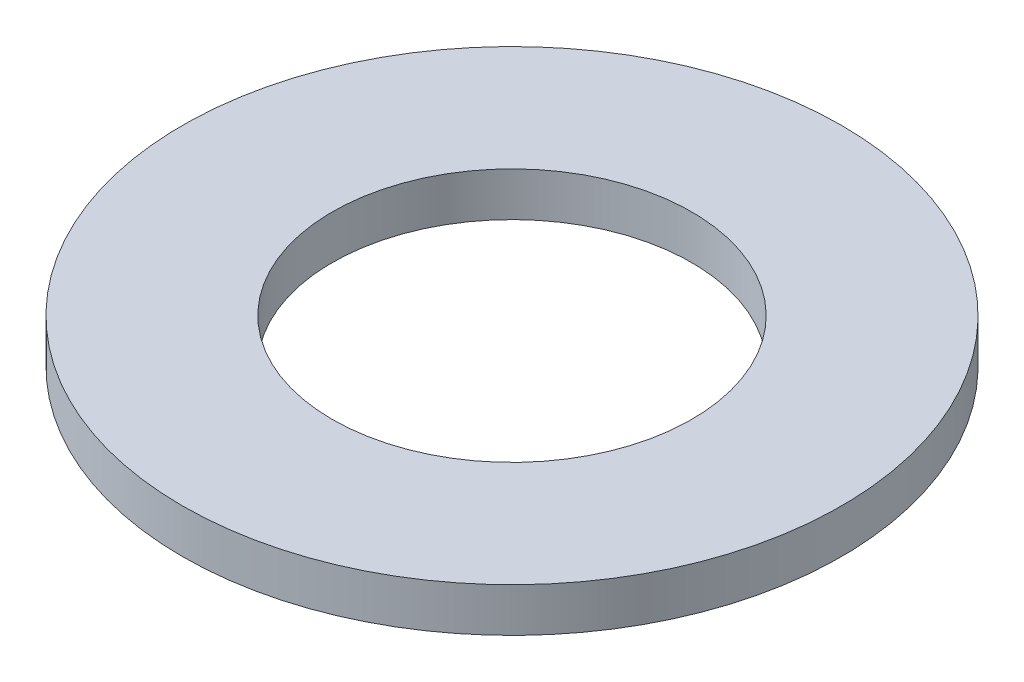
from build123d import *

# Parameters (mm, degrees)
SKETCH1_R           = 82.5
BOSS_EXTRUDE1_DEPTH = 11
SKETCH2_R           = 45
CUT_EXTRUDE1_DEPTH  = 118.19001664


with BuildPart() as part:
    # Sketch1 → Boss-Extrude1 (new body)
    with BuildSketch(Plane(origin=(0, 0, 0), x_dir=(1, 0, 0), z_dir=(0, 1, 0))):
        Circle(SKETCH1_R)
    extrude(amount=BOSS_EXTRUDE1_DEPTH)

    # Sketch2 → Cut-Extrude1 (cut, through all)
    with BuildSketch(Plane(origin=(0, 0, 0), x_dir=(1, 0, 0), z_dir=(0, 1, 0))):
        Circle(SKETCH2_R)
    extrude(amount=CUT_EXTRUDE1_DEPTH, mode=Mode.SUBTRACT)


solid = part.part
